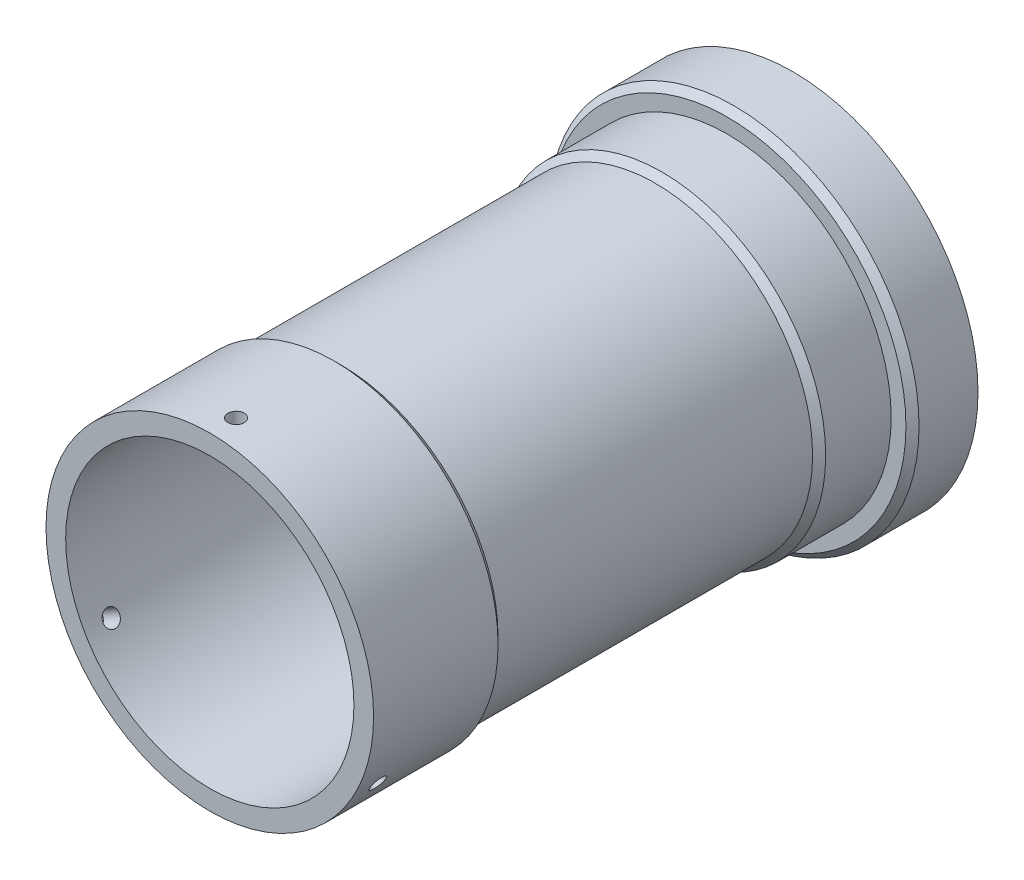
from build123d import *

# Parameters (mm, degrees)
HOLE_WIZARD_M3_1_D       = 2.5
HOLE_WIZARD_M3_1_DEPTH   = 7
HOLE_WIZARD_M3_1_TIP     = 0.751075774
CHAMFER_2_SIZE           = 1
SKETCH_20_W              = 1.25
SKETCH_20_H              = 28.25
PATTERN_CIRCULAR_1_COUNT = 3


with BuildPart() as part:
    # 草图1 → 旋转1 (revolve)
    with BuildSketch(Plane(origin=(0, 0, 0), x_dir=(1, 0, 0), z_dir=(0, 1, 0))):
        Polygon((25, 0), (25, 19), (24, 19), (24, 69), (25, 69), (25, 79), (28.25, 79), (28.25, 89), (23, 89), (23, 90.5), (22, 90.5), (22, 0), align=None)
    revolve(axis=Axis((0, 0, 0), (0, 0, -1)))

    # M3 螺纹孔1
    with Locations(Plane(origin=(0, 0, -89), x_dir=(-1, 0, 0), z_dir=(0, 0, -1))):
        with Locations((-18.207999616, 18.207999616), (18.207999616, 18.207999616), (18.207999616, -18.207999616), (-18.207999616, -18.207999616)):
            Hole(HOLE_WIZARD_M3_1_D / 2, depth=HOLE_WIZARD_M3_1_DEPTH)
            with Locations((0, 0, -(HOLE_WIZARD_M3_1_DEPTH + HOLE_WIZARD_M3_1_TIP / 2))):  # 118° drill point
                Cone(0, HOLE_WIZARD_M3_1_D / 2, HOLE_WIZARD_M3_1_TIP, mode=Mode.SUBTRACT)

    # 倒角2
    chamfer_2_edges = [part.edges().sort_by_distance(p)[0] for p in [
        (-28.25, 0, -79),
        (-24, 0, -69),
        (-24, 0, -19),
    ]]
    chamfer(chamfer_2_edges, length=CHAMFER_2_SIZE - 0.0001)  # a hair under: the kernel refuses the full size

    # 草图20 → M3 螺纹孔2 (revolve, cut)
    with BuildSketch(Plane(origin=(0, 0, -4), x_dir=(0, 0, -1), z_dir=(1, 0, 0))):
        with Locations((0.625, 14.125)):
            Rectangle(SKETCH_20_W, SKETCH_20_H)
    hole_wizard_m3_2 = revolve(axis=Axis((0, -6.35, -4), (0, 1, 0)), mode=Mode.SUBTRACT)

    # 阵列(圆周)1: M3 螺纹孔2 ×3 about axis
    pattern_circular_1_axis = Axis((0, 0, 0), (0, 0, 1))
    for i in range(1, PATTERN_CIRCULAR_1_COUNT):
        add(hole_wizard_m3_2.rotate(pattern_circular_1_axis, i * 360 / PATTERN_CIRCULAR_1_COUNT), mode=Mode.SUBTRACT)


solid = part.part
